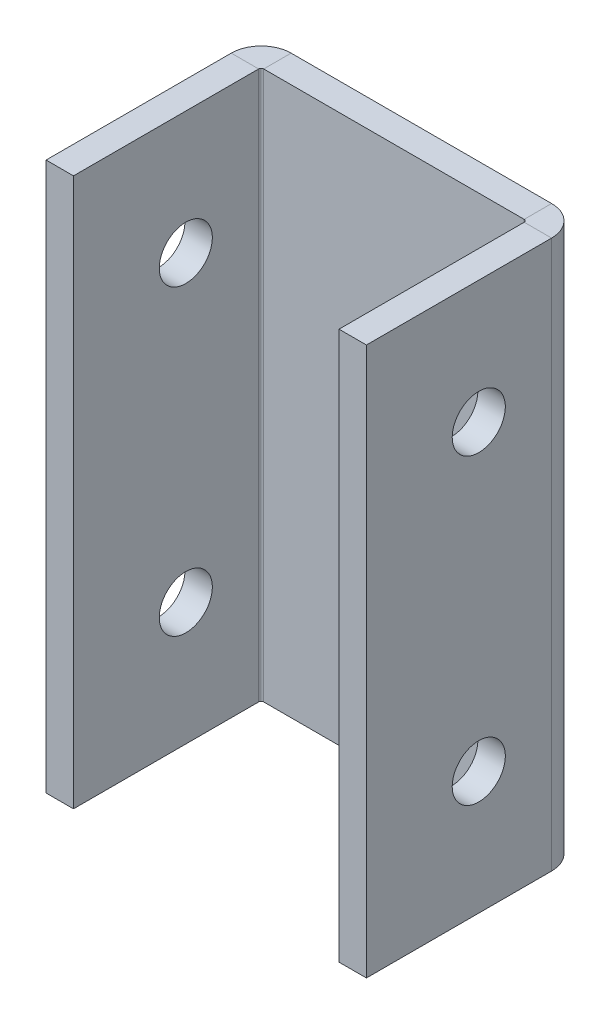
from build123d import *

# Parameters (mm, degrees)
CROQUIS1_W                    = 199
CROQUIS1_H                    = 160
BRIDA_BASE1_DEPTH             = 8
PLIEGUE_START                 = -62.828947368
PLIEGUE_CROQUIZADO1_DEPTH     = 160
PLIEGUE_CROQUIZADO1_2_DEPTH   = 160
TALADRO_DE_MARGEN_PARA_M141_D = 15.5


# Read off the part's stored shape, not the designer's step: Pliegue croquizado1
# Sheet-metal steps are written as plain solids
with BuildPart() as part:
    # Croquis1 → Brida base1 (new body)
    with BuildSketch(Plane.XY):
        with Locations((8.132704294, 17.171052632)):
            Rectangle(CROQUIS1_W, CROQUIS1_H)
    extrude(amount=-BRIDA_BASE1_DEPTH)

    # Pliegue croquizado1 outline → Pliegue croquizado1 (cut)
    with BuildSketch(Plane(origin=(0, 0, 0), x_dir=(1, 0, 0), z_dir=(0, 1, 0)).offset(PLIEGUE_START)):
        with BuildLine():
            Line((107.632704294, 8), (46.146104294, 8))
            ThreePointArc((46.146104294, 8), (52.057652315, 5.696267134), (54.851596813, 0))
            Line((54.851596813, 0), (107.632704294, 0))
            Line((107.632704294, 0), (107.632704294, 8))
        make_face()
        with BuildLine():
            ThreePointArc((-38.586188225, 0), (-35.792243727, 5.696267134), (-29.880695706, 8))
            Line((-29.880695706, 8), (-91.367295706, 8))
            Line((-91.367295706, 8), (-91.367295706, 0))
            Line((-91.367295706, 0), (-38.586188225, 0))
        make_face()
    extrude(amount=PLIEGUE_CROQUIZADO1_DEPTH, mode=Mode.SUBTRACT)

    # Pliegue croquizado1 2 outline → Pliegue croquizado1 2 (add)
    with BuildSketch(Plane(origin=(0, 0, 0), x_dir=(1, 0, 0), z_dir=(0, 1, 0)).offset(PLIEGUE_START)):
        with BuildLine():
            ThreePointArc((54.882704294, -0.7366), (54.874923959, -0.36797172), (54.851596813, 0))
            Line((54.851596813, 0), (46.146104294, 0))
            ThreePointArc((46.146104294, 0), (46.666959149, -0.215745145), (46.882704294, -0.7366))
            Line((46.882704294, -0.7366), (46.882704294, -54.782966119))
            Line((46.882704294, -54.782966119), (54.882704294, -54.782966119))
            Line((54.882704294, -54.782966119), (54.882704294, -0.7366))
        make_face()
        with BuildLine():
            Line((-29.880695706, 0), (-38.586188225, 0))
            ThreePointArc((-38.586188225, 0), (-38.609515371, -0.36797172), (-38.617295706, -0.7366))
            Line((-38.617295706, -0.7366), (-38.617295706, -54.782966119))
            Line((-38.617295706, -54.782966119), (-30.617295706, -54.782966119))
            Line((-30.617295706, -54.782966119), (-30.617295706, -0.7366))
            ThreePointArc((-30.617295706, -0.7366), (-30.401550561, -0.215745145), (-29.880695706, 0))
        make_face()
    extrude(amount=PLIEGUE_CROQUIZADO1_2_DEPTH)

    # Taladro de margen para M141 (through all)
    with Locations(Plane.ZY.offset(38.617295706)):
        with Locations((22, -26.978947368), (22, 61.321052632)):
            Hole(TALADRO_DE_MARGEN_PARA_M141_D / 2)


solid = part.part
